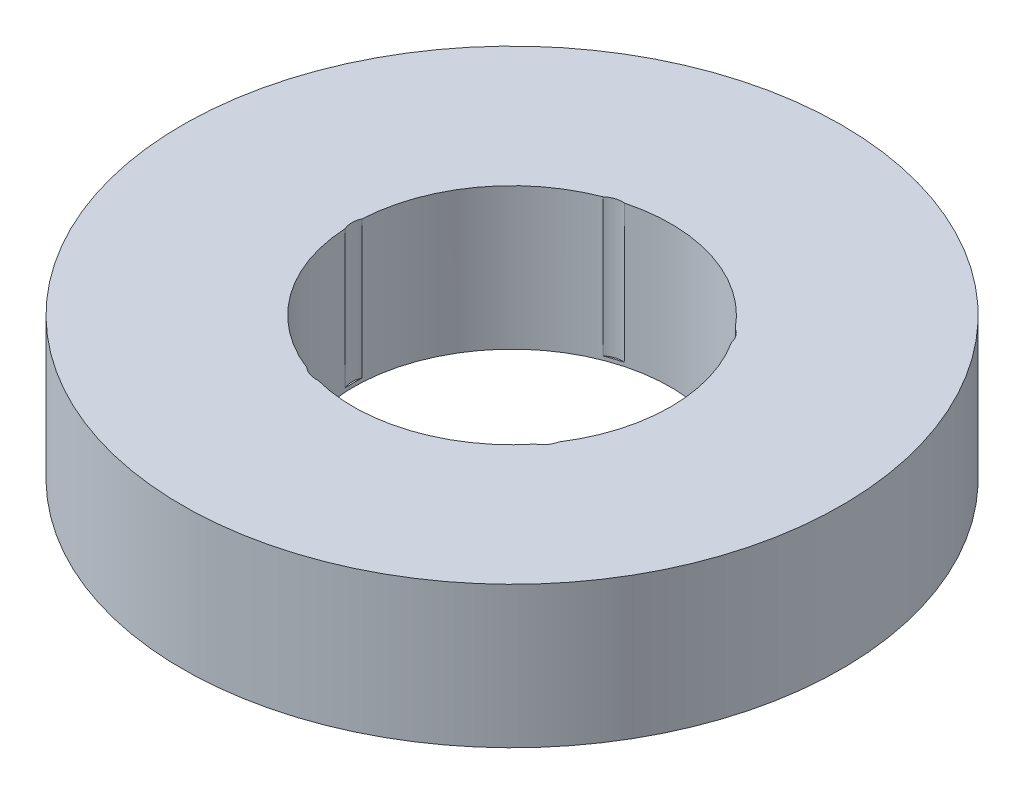
from build123d import *

# Parameters (mm, degrees)
SKETCH1_R           = 67.5
BOSS_EXTRUDE1_DEPTH = 29
SKETCH2_R           = 32.5
CUT_EXTRUDE1_DEPTH  = 100.767229089
SKETCH3_R           = 4.38640504
CUT_EXTRUDE2_DEPTH  = 28.236205131
CIRPATTERN1_COUNT   = 5


with BuildPart() as part:
    # Sketch1 → Boss-Extrude1 (new body)
    with BuildSketch(Plane(origin=(0, 0, 0), x_dir=(1, 0, 0), z_dir=(0, 1, 0))):
        Circle(SKETCH1_R)
    extrude(amount=BOSS_EXTRUDE1_DEPTH)

    # Sketch2 → Cut-Extrude1 (cut, through all)
    with BuildSketch(Plane(origin=(0, 0, 0), x_dir=(1, 0, 0), z_dir=(0, 1, 0))):
        Circle(SKETCH2_R)
    extrude(amount=CUT_EXTRUDE1_DEPTH, mode=Mode.SUBTRACT)

    # Sketch3 → Cut-Extrude2 (cut)
    with BuildSketch(Plane(origin=(0, 29, 0), x_dir=(1, 0, 0), z_dir=(0, 1, 0))):
        with Locations((-28.433169158, 0)):
            Circle(SKETCH3_R)
    cut_extrude2 = extrude(amount=-CUT_EXTRUDE2_DEPTH, mode=Mode.SUBTRACT)

    # CirPattern1: Cut-Extrude2 ×5 about axis
    cirpattern1_axis = Axis((0, 0, 0), (0, 1, 0))
    for i in range(1, CIRPATTERN1_COUNT):
        add(cut_extrude2.rotate(cirpattern1_axis, i * 360 / CIRPATTERN1_COUNT), mode=Mode.SUBTRACT)


solid = part.part
